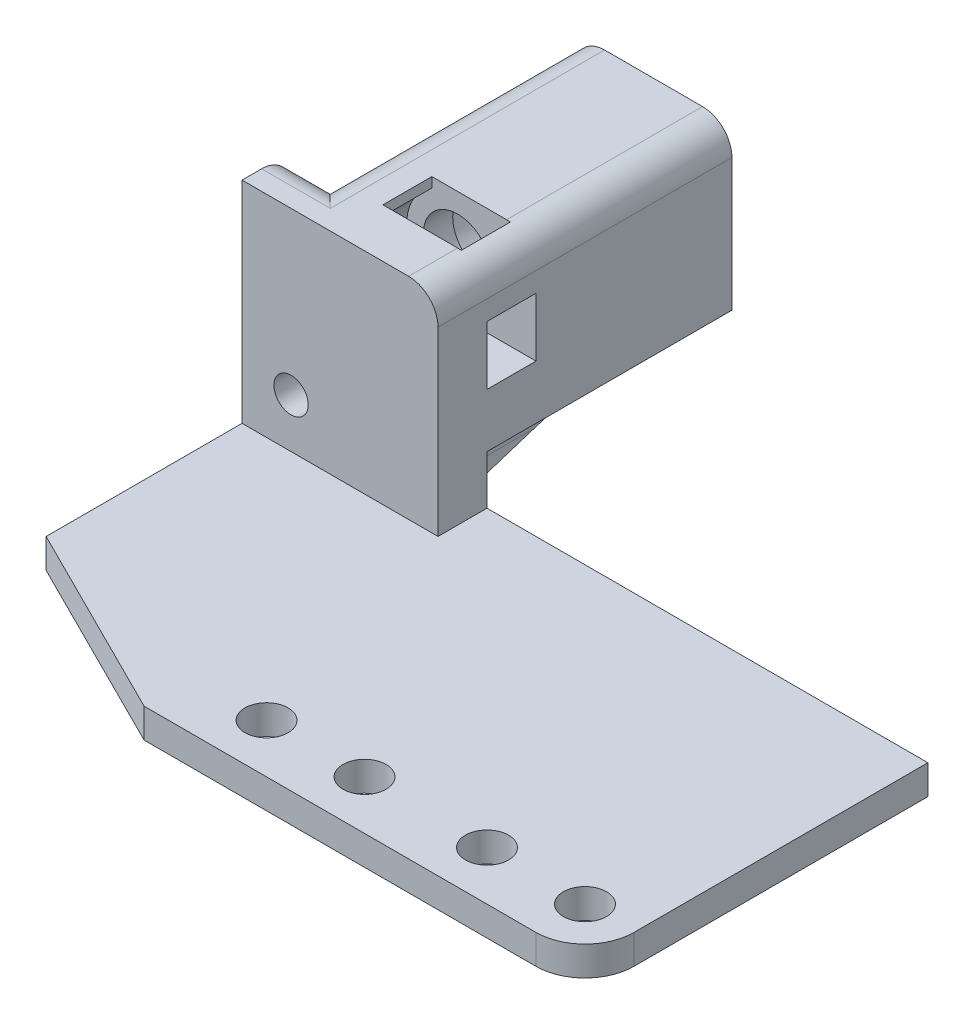
from build123d import *

# Parameters (mm, degrees)
SKETCH_4_W              = 25
SKETCH_4_H              = 10
EXTRUDE_1_DEPTH         = 3
HOLE_WIZARD_4_4_4_4_1_D = 4.4
SKETCH_8_W              = 65
SKETCH_8_H              = 25
EXTRUDE_2_DEPTH         = 3
SKETCH_18_W             = 20
SKETCH_18_H             = 25
CUT_EXTRUDE_1_DEPTH     = 10
SKETCH_19_W             = 20
SKETCH_19_H             = 25
EXTRUDE_3_DEPTH         = 3
EXTRUDE_4_DEPTH         = 3
SKETCH_21_W             = 65
SKETCH_21_H             = 5
EXTRUDE_5_DEPTH         = 15
SKETCH_23_W             = 32.5
SKETCH_23_H             = 5
CUT_EXTRUDE_2_DEPTH     = 15
HOLE_WIZARD_3_5_3_5_1_D = 3.5
SKETCH_28_W             = 18
SKETCH_28_H             = 25
EXTRUDE_6_DEPTH         = 3
SKETCH_30_W             = 15
SKETCH_30_H             = 25
EXTRUDE_8_DEPTH         = 15
HOLE_WIZARD_1_D         = 10.2
EXTRUDE_9_DEPTH         = 3
EXTRUDE_10_DEPTH        = 3
HOLE_WIZARD_2_D         = 6
FILLET_4_R              = 3
SKETCH_39_W             = 18
SKETCH_39_H             = 28
CUT_EXTRUDE_3_DEPTH     = 75.283241717
SKETCH_40_W             = 32.5
SKETCH_40_H             = 15
EXTRUDE_11_DEPTH        = 5
EXTRUDE_START           = 25
EXTRUDE_12_DEPTH        = 25
EXTRUDE_START_2         = 3
SKETCH_45_R             = 5.2
SKETCH_45_R_2           = 3.5
EXTRUDE_15_DEPTH        = 3
SKETCH_46_W             = 5
SKETCH_46_H             = 3
CUT_EXTRUDE_4_DEPTH     = 90.140338792
SKETCH_50_W             = 8
SKETCH_50_H             = 5
CUT_EXTRUDE_5_DEPTH     = 4
CUT_EXTRUDE_6_DEPTH     = 25
CUT_EXTRUDE_7_DEPTH     = 25
EXTRUDE_16_DEPTH        = 2
FILLET_6_R              = 5
SKETCH_56_W             = 65.702290987
SKETCH_56_H             = 31.946087045
CUT_EXTRUDE_10_DEPTH    = 0.5
SKETCH_58_W             = 45
SKETCH_58_H             = 21.5
CUT_EXTRUDE_11_DEPTH    = 10
FILLET_7_R              = 3
EXTRUDE_17_DEPTH        = 3
HOLE_WIZARD_4_4_4_4_2_D = 4.4
FILLET_8_R              = 5


with BuildPart() as part:
    # 草图4 → 凸台-拉伸1 (new body)
    with BuildSketch(Plane(origin=(0, 0, 0), x_dir=(1, 0, 0), z_dir=(0, 1, 0))):
        with Locations((12.5, 5)):
            Rectangle(SKETCH_4_W, SKETCH_4_H)
    extrude(amount=EXTRUDE_1_DEPTH)

    # Ø4.4 (4.4) 直径孔1 (through all)
    with Locations(Plane(origin=(0, 3, 0), x_dir=(1, 0, 0), z_dir=(0, 1, 0))):
        with Locations((7.5, 5), (17.5, 5)):
            Hole(HOLE_WIZARD_4_4_4_4_1_D / 2)

    # 草图8 → 凸台-拉伸2 (add)
    with BuildSketch(Plane.XZ):
        with Locations((32.5, -22.5)):
            Rectangle(SKETCH_8_W, SKETCH_8_H)
    extrude(amount=-EXTRUDE_2_DEPTH)

    # 草图18 → 切除-拉伸1 (cut)
    with BuildSketch(Plane(origin=(0, 3, 0), x_dir=(1, 0, 0), z_dir=(0, 1, 0))):
        with Locations((55, 22.5)):
            Rectangle(SKETCH_18_W, SKETCH_18_H)
    extrude(amount=-CUT_EXTRUDE_1_DEPTH, mode=Mode.SUBTRACT)

    # 草图19 → 凸台-拉伸3 (add)
    with BuildSketch(Plane(origin=(0, 3, 0), x_dir=(1, 0, 0), z_dir=(0, 1, 0))):
        with Locations((-10, 22.5)):
            Rectangle(SKETCH_19_W, SKETCH_19_H)
    extrude(amount=-EXTRUDE_3_DEPTH)

    # 草图20 → 凸台-拉伸4 (add)
    with BuildSketch(Plane(origin=(0, 3, 0), x_dir=(1, 0, 0), z_dir=(0, 1, 0))):
        Polygon((-20, 10), (0, 10), (0, 0), align=None)
        Polygon((25, 10), (45, 10), (25, 0), align=None)
    extrude(amount=-EXTRUDE_4_DEPTH)

    # 草图21 → 凸台-拉伸5 (add)
    with BuildSketch(Plane(origin=(0, 3, 0), x_dir=(1, 0, 0), z_dir=(0, 1, 0))):
        with Locations((12.5, 32.5)):
            Rectangle(SKETCH_21_W, SKETCH_21_H)
    extrude(amount=EXTRUDE_5_DEPTH)

    # 草图23 → 切除-拉伸2 (cut)
    with BuildSketch(Plane(origin=(0, 18, 0), x_dir=(1, 0, 0), z_dir=(0, 1, 0))):
        with Locations((28.75, 32.5)):
            Rectangle(SKETCH_23_W, SKETCH_23_H)
    extrude(amount=-CUT_EXTRUDE_2_DEPTH, mode=Mode.SUBTRACT)

    # Ø3.5 (3.5) 直径孔1 (through all)
    with Locations(Plane.XY.offset(-30)):
        with Locations((-15, 8)):
            Hole(HOLE_WIZARD_3_5_3_5_1_D / 2)

    # 草图28 → 凸台-拉伸6 (add)
    with BuildSketch(Plane(origin=(0, 3, 0), x_dir=(1, 0, 0), z_dir=(0, 1, 0))):
        with Locations((54, 22.5)):
            Rectangle(SKETCH_28_W, SKETCH_28_H)
    extrude(amount=-EXTRUDE_6_DEPTH)

    # 草图30 → 凸台-拉伸8 (add)
    with BuildSketch(Plane(origin=(0, 3, 0), x_dir=(1, 0, 0), z_dir=(0, 1, 0))):
        with Locations((55.5, 22.5)):
            Rectangle(SKETCH_30_W, SKETCH_30_H)
    extrude(amount=EXTRUDE_8_DEPTH)

    # 孔1 (through all)
    with Locations(Plane(origin=(0, 0, -35), x_dir=(-1, 0, 0), z_dir=(0, 0, -1))):
        with Locations((-55.5, 10.5)):
            Hole(HOLE_WIZARD_1_D / 2)

    # 草图35 → 凸台-拉伸9 (add)
    with BuildSketch(Plane.XY.offset(-10)):
        Polygon((48, 18), (45, 3), (45, 0), (63, 0), (63, 18), align=None)
    extrude(amount=EXTRUDE_9_DEPTH)

    # 草图36 → 凸台-拉伸10 (add)
    with BuildSketch(Plane(origin=(0, 3, 0), x_dir=(1, 0, 0), z_dir=(0, 1, 0))):
        Polygon((25, 0), (45, 7), (45, 10), align=None)
    extrude(amount=-EXTRUDE_10_DEPTH)

    # 孔2 (through all)
    with Locations(Plane(origin=(0, 0, -10), x_dir=(-1, 0, 0), z_dir=(0, 0, -1))):
        with Locations((-55.5, 10.5)):
            Hole(HOLE_WIZARD_2_D / 2)

    # 圆角4
    fillet_4_edges = [part.edges().sort_by_distance(p)[0] for p in [
        (63, 18, -21),
    ]]
    fillet(fillet_4_edges, radius=FILLET_4_R)

    # 草图39 → 切除-拉伸3 (cut, through all)
    with BuildSketch(Plane.XZ):
        with Locations((54, -21)):
            Rectangle(SKETCH_39_W, SKETCH_39_H)
    extrude(amount=-CUT_EXTRUDE_3_DEPTH, mode=Mode.SUBTRACT)

    # 草图40 → 凸台-拉伸11 (add)
    with BuildSketch(Plane(origin=(0, 0, -35), x_dir=(-1, 0, 0), z_dir=(0, 0, -1))):
        with Locations((-28.75, 10.5)):
            Rectangle(SKETCH_40_W, SKETCH_40_H)
        Polygon((-12.5, 18), (20, 18), (20, 25), (-45, 25), (-45, 18), align=None)
    extrude(amount=-EXTRUDE_11_DEPTH)

    # 草图41 → 凸台-拉伸12 (add)
    with BuildSketch(Plane(origin=(0, 0, -35), x_dir=(-1, 0, 0), z_dir=(0, 0, -1)).offset(EXTRUDE_START)):
        with BuildLine():
            Line((8, 8), (13.25, 8))
            ThreePointArc((13.25, 8), (14.189907413, 9.551209206), (16, 9.436140662))
            Line((16, 9.436140662), (16, 25))
            Line((16, 25), (0, 25))
            Line((0, 25), (0, 8))
            Line((0, 8), (8, 8))
        make_face()
        with BuildLine():
            ThreePointArc((13.2, 19), (11.676955262, 15.323044738), (8, 13.8))
            ThreePointArc((8, 13.8), (4.323044738, 22.676955262), (13.2, 19))
        make_face(mode=Mode.SUBTRACT)
    extrude(amount=-EXTRUDE_12_DEPTH)

    # 草图45 → 凸台-拉伸15 (add)
    with BuildSketch(Plane(origin=(0, 0, -40), x_dir=(-1, 0, 0), z_dir=(0, 0, -1)).offset(EXTRUDE_START_2)):
        with Locations((8, 19)):
            Circle(SKETCH_45_R)
        with Locations((8, 19)):
            Circle(SKETCH_45_R_2, mode=Mode.SUBTRACT)
    extrude(amount=-EXTRUDE_15_DEPTH)

    # 草图46 → 切除-拉伸4 (cut, through all)
    with BuildSketch(Plane.ZY.offset(16)):
        with Locations((-37.5, 18)):
            Rectangle(SKETCH_46_W, SKETCH_46_H)
        with Locations((-37.5, 15)):
            Rectangle(SKETCH_46_W, SKETCH_46_H)
    extrude(amount=-CUT_EXTRUDE_4_DEPTH, mode=Mode.SUBTRACT)

    # 草图50 → 切除-拉伸5 (cut)
    with BuildSketch(Plane(origin=(0, 25, 0), x_dir=(1, 0, 0), z_dir=(0, 1, 0))):
        with Locations((-6.625, 37.5)):
            Rectangle(SKETCH_50_W, SKETCH_50_H)
    extrude(amount=-CUT_EXTRUDE_5_DEPTH, mode=Mode.SUBTRACT)

    # 草图51 → 切除-拉伸6 (cut)
    with BuildSketch(Plane(origin=(0, 0, -60), x_dir=(-1, 0, 0), z_dir=(0, 0, -1))):
        Polygon((16, 13.5), (10.5, 8), (16, 8), align=None)
    extrude(amount=-CUT_EXTRUDE_6_DEPTH, mode=Mode.SUBTRACT)

    # 草图52 → 切除-拉伸7 (cut)
    with BuildSketch(Plane(origin=(0, 0, -60), x_dir=(-1, 0, 0), z_dir=(0, 0, -1))):
        Polygon((6.625, 8), (16, 13.5), (10.5, 8), align=None)
    extrude(amount=-CUT_EXTRUDE_7_DEPTH, mode=Mode.SUBTRACT)

    # 草图54 → 凸台-拉伸16 (add)
    with BuildSketch(Plane(origin=(-6.625, 0, 0), x_dir=(0, 0, -1), z_dir=(1, 0, 0))):
        Polygon((35, 0), (60, 8), (35, 8), align=None)
    extrude(amount=EXTRUDE_16_DEPTH)

    # 圆角6
    # the kernel refuses this fillet: 5 mm, written as the material it adds along each edge
    with BuildSketch(Plane(origin=(-6.625, 8, -60), x_dir=(-0.8625249057662363, 0.5060146113828583, 0), z_dir=(0, 0, 1))) as fillet_6_piece_1_section:
        with BuildLine():
            CenterArc((FILLET_6_R * 0.572720144444, FILLET_6_R), FILLET_6_R, 210.398727714, 59.601272286)
            Line((-FILLET_6_R * 0.289804761322, FILLET_6_R * 0.493985388617), (0, 0))
            Line((0, 0), (FILLET_6_R * 0.572720144444, 0))
        make_face()
    fillet_6_piece_1 = extrude(amount=32.159001806, mode=Mode.PRIVATE)
    fillet_6_piece_1 = split(fillet_6_piece_1, bisect_by=Plane(origin=(-6.625, 8, -30), z_dir=(0, 0, -1)), keep=Keep.TOP, mode=Mode.PRIVATE)
    fillet_6_piece_1 = split(fillet_6_piece_1, bisect_by=Plane(origin=(-6.625, 8, -60), z_dir=(0, 0.9524241471993243, 0.3047757271037836)), keep=Keep.TOP, mode=Mode.PRIVATE)
    add(fillet_6_piece_1)
    with BuildSketch(Plane(origin=(-4.625, 8, -72.464794172), x_dir=(0, -1, 0), z_dir=(0, 0, 1))) as fillet_6_piece_2_section:
        with BuildLine():
            CenterArc((4.985917669, 5), FILLET_6_R, 184.301222305, 85.698777695)
            Line((0, 4.625), (0, 0))
            Line((0, 0), (4.985917669, 0))
        make_face()
    fillet_6_piece_2 = extrude(amount=49.929588344, mode=Mode.PRIVATE)
    fillet_6_piece_2 = split(fillet_6_piece_2, bisect_by=Plane(origin=(-4.625, 8, -30), z_dir=(0, 0, -1)), keep=Keep.TOP, mode=Mode.PRIVATE)
    fillet_6_piece_2 = split(fillet_6_piece_2, bisect_by=Plane(origin=(-4.625, 11.618227626, -71.306961332), z_dir=(0, 0.9524241471993243, 0.3047757271037836)), keep=Keep.TOP, mode=Mode.PRIVATE)
    add(fillet_6_piece_2)

    # 草图56 → 切除-拉伸10 (cut)
    with BuildSketch(Plane(origin=(0, 25, 0), x_dir=(1, 0, 0), z_dir=(0, 1, 0))):
        with Locations((12.851145494, 45.973043523)):
            Rectangle(SKETCH_56_W, SKETCH_56_H)
    extrude(amount=-CUT_EXTRUDE_10_DEPTH, mode=Mode.SUBTRACT)

    # 草图58 → 切除-拉伸11 (cut)
    with BuildSketch(Plane(origin=(0, 0, -35), x_dir=(-1, 0, 0), z_dir=(0, 0, -1))):
        with Locations((-22.5, 13.75)):
            Rectangle(SKETCH_58_W, SKETCH_58_H)
    extrude(amount=-CUT_EXTRUDE_11_DEPTH, mode=Mode.SUBTRACT)

    # 圆角7
    # the kernel refuses this fillet: 3 mm, written as the material it takes off along each edge
    with BuildSketch(Plane(origin=(0, 24.5, -67.5), x_dir=(0, -1, 0), z_dir=(0, 0, 1))) as fillet_7_piece_1:
        with BuildLine():
            CenterArc((FILLET_7_R, -FILLET_7_R), FILLET_7_R, 90, 90)
            Line((0, -FILLET_7_R), (0, 0))
            Line((0, 0), (FILLET_7_R, 0))
        make_face()
    extrude(amount=45, mode=Mode.SUBTRACT)
    with BuildSketch(Plane(origin=(-16, 24.5, -35), x_dir=(0, -1, 0), z_dir=(0, 0, -1))) as fillet_7_piece_2:
        with BuildLine():
            CenterArc((FILLET_7_R, -FILLET_7_R), FILLET_7_R, 90, 90)
            Line((0, -FILLET_7_R), (0, 0))
            Line((0, 0), (FILLET_7_R, 0))
        make_face()
    extrude(amount=32.5, mode=Mode.SUBTRACT)
    with BuildSketch(Plane(origin=(-16, 24.5, -35), x_dir=(0, -1, 0), z_dir=(-1, 0, 0))) as fillet_7_piece_3:
        with BuildLine():
            CenterArc((FILLET_7_R, FILLET_7_R), FILLET_7_R, 180, 90)
            Line((0, FILLET_7_R), (0, 0))
            Line((0, 0), (FILLET_7_R, 0))
        make_face()
    extrude(amount=11.5, mode=Mode.SUBTRACT)
    with BuildSketch(Plane(origin=(-16, 24.5, -27.5), x_dir=(0, -1, 0), z_dir=(0, 0, -1))) as fillet_7_piece_4a_section:
        with BuildLine():
            CenterArc((FILLET_7_R, -FILLET_7_R), FILLET_7_R, 90, 90)
            Line((0, -FILLET_7_R), (0, 0))
            Line((0, 0), (FILLET_7_R, 0))
        make_face()
    fillet_7_piece_4a = extrude(amount=32.5, mode=Mode.PRIVATE)
    fillet_7_piece_4a = split(fillet_7_piece_4a, bisect_by=Plane(origin=(-16, 24.5, -35), z_dir=(0, 0, 1)), keep=Keep.TOP, mode=Mode.PRIVATE)
    fillet_7_piece_4a = split(fillet_7_piece_4a, bisect_by=Plane(origin=(-16, 24.5, -30), z_dir=(0, 0, -1)), keep=Keep.TOP, mode=Mode.PRIVATE)
    with BuildSketch(Plane(origin=(-8.5, 24.5, -35), x_dir=(0, -1, 0), z_dir=(-1, 0, 0))) as fillet_7_piece_4b_section:
        with BuildLine():
            CenterArc((FILLET_7_R, FILLET_7_R), FILLET_7_R, 180, 90)
            Line((0, FILLET_7_R), (0, 0))
            Line((0, 0), (FILLET_7_R, 0))
        make_face()
    fillet_7_piece_4b = extrude(amount=11.5, mode=Mode.PRIVATE)
    fillet_7_piece_4b = split(fillet_7_piece_4b, bisect_by=Plane(origin=(-16, 24.5, -35), z_dir=(1, 0, 0)), keep=Keep.TOP, mode=Mode.PRIVATE)
    fillet_7_piece_4b = fillet_7_piece_4b - Plane(origin=(-8, 19, -35), x_dir=(-1, 0, 0), z_dir=(0, 0, -1)) * Cylinder(5.2, 35, mode=Mode.PRIVATE)
    fillet_7_piece_4b = split(fillet_7_piece_4b, bisect_by=Plane(origin=(-10.625, 24.5, -35), z_dir=(-1, 0, 0)), keep=Keep.TOP, mode=Mode.PRIVATE)
    fillet_7_piece_4 = fillet_7_piece_4a & fillet_7_piece_4b
    add(fillet_7_piece_4, mode=Mode.SUBTRACT)

    # 草图60 → 凸台-拉伸17 (add)
    with BuildSketch(Plane(origin=(0, 3, 0), x_dir=(1, 0, 0), z_dir=(0, 1, 0))):
        Polygon((45, 7), (45, 0), (25, 0), align=None)
    extrude(amount=-EXTRUDE_17_DEPTH)

    # Ø4.4 (4.4) 直径孔2 (through all)
    with Locations(Plane(origin=(0, 3, 0), x_dir=(1, 0, 0), z_dir=(0, 1, 0))):
        with Locations((30, 5), (40, 5)):
            Hole(HOLE_WIZARD_4_4_4_4_2_D / 2)

    # 圆角8
    fillet_8_edges = [part.edges().sort_by_distance(p)[0] for p in [
        (45, 1.5, 0),
    ]]
    fillet(fillet_8_edges, radius=FILLET_8_R)


solid = part.part
